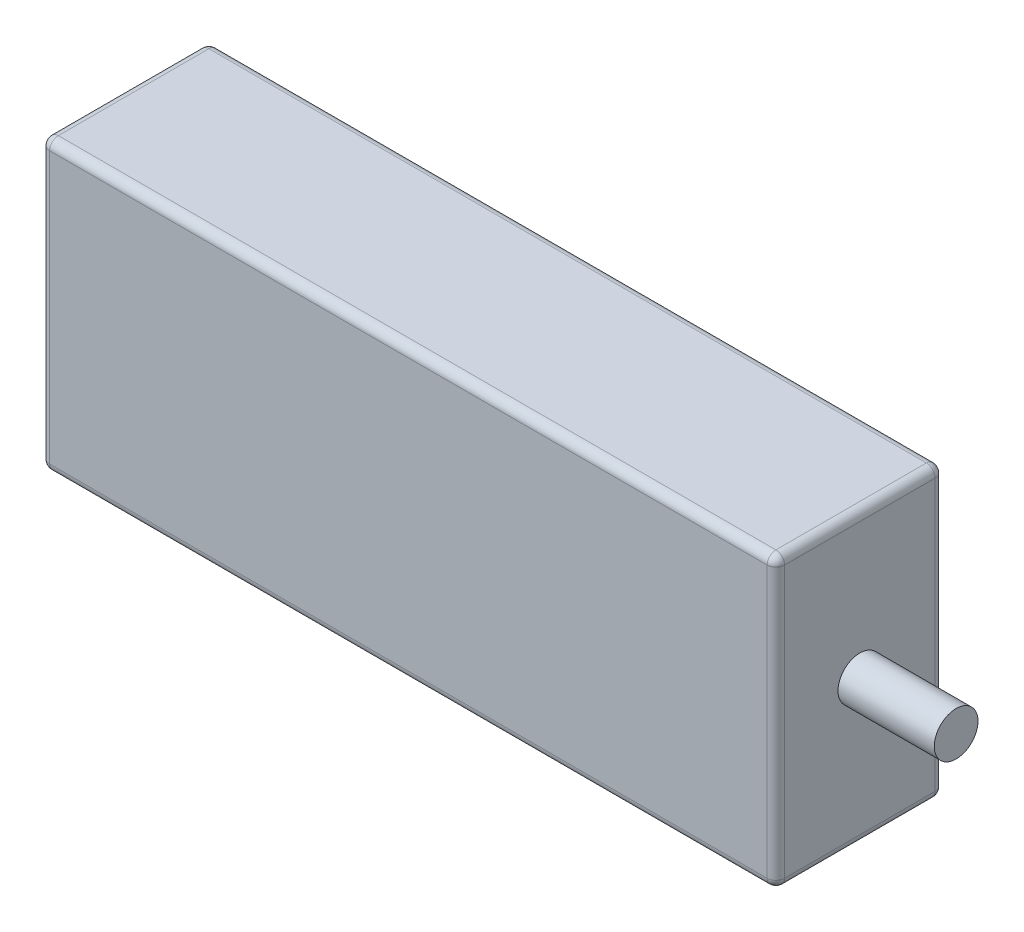
from build123d import *

# Parameters (mm, degrees)
ESQUISSE1_W        = 168
ESQUISSE1_H        = 66
BOSS_EXTRU_1_DEPTH = 38.4
CONG_1_R           = 2
ESQUISSE2_R        = 5
BOSS_EXTRU_2_DEPTH = 22


with BuildPart() as part:
    # Esquisse1 → Boss.-Extru.1 (new body)
    with BuildSketch(Plane.XY):
        with Locations((84, 33)):
            Rectangle(ESQUISSE1_W, ESQUISSE1_H)
    extrude(amount=BOSS_EXTRU_1_DEPTH)

    # Congé1
    cong_1_edges = [part.edges().sort_by_distance(p)[0] for p in [
        (0, 0, 19.2),
        (84, 0, 0),
        (0, 33, 0),
        (168, 0, 19.2),
        (168, 33, 0),
        (168, 66, 19.2),
        (0, 66, 19.2),
        (84, 66, 0),
        (84, 66, 38.4),
        (168, 33, 38.4),
        (84, 0, 38.4),
        (0, 33, 38.4),
    ]]
    fillet(cong_1_edges, radius=CONG_1_R)

    # Esquisse2 → Boss.-Extru.2 (add)
    with BuildSketch(Plane(origin=(168, 0, 0), x_dir=(0, 0, -1), z_dir=(1, 0, 0))):
        with Locations((-19.2, 33)):
            Circle(ESQUISSE2_R)
    extrude(amount=BOSS_EXTRU_2_DEPTH)


solid = part.part
